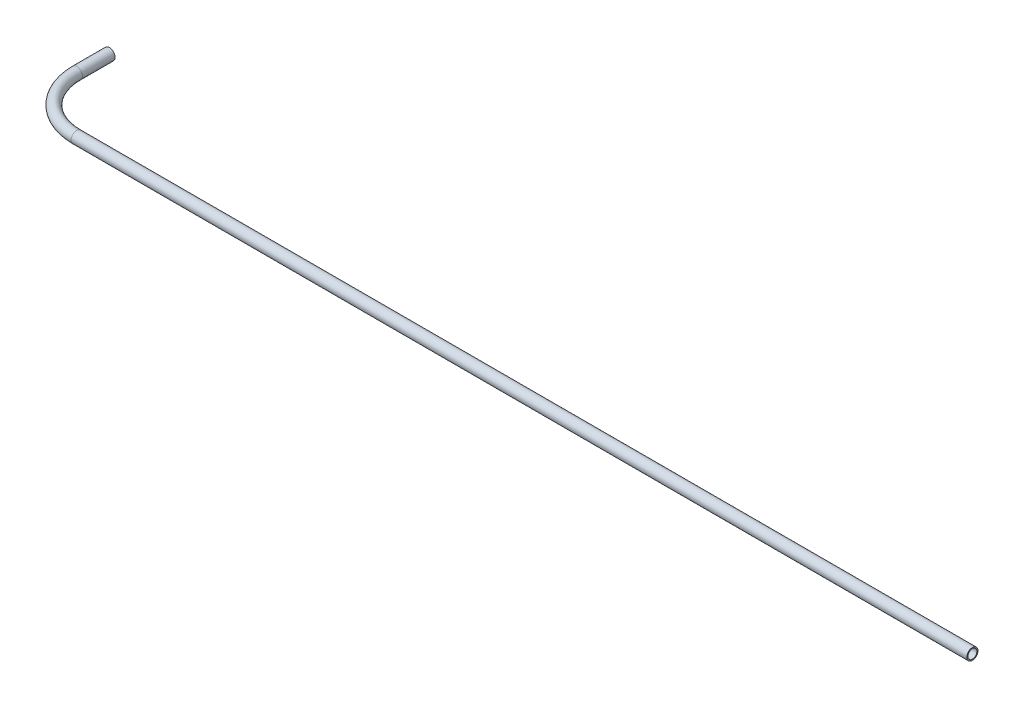
from build123d import *

# Parameters (mm, degrees)
SKETCH1_R           = 0.254
SKETCH1_R_2         = 0.2032
BOSS_EXTRUDE1_DEPTH = 40
SKETCH4_R           = 0.254
SKETCH4_R_2         = 0.2032


with BuildPart() as part:
    # Sketch1 → Boss-Extrude1 (new body)
    with BuildSketch(Plane(origin=(0, 0, 0), x_dir=(0, 0, -1), z_dir=(1, 0, 0))):
        Circle(SKETCH1_R)
        Circle(SKETCH1_R_2, mode=Mode.SUBTRACT)
    extrude(amount=BOSS_EXTRUDE1_DEPTH)

    # Sweep1: sweep along a path in Sketch3
    with BuildLine(Plane(origin=(-24.730187621, 0, -3.035061507), x_dir=(-1, 0, 0), z_dir=(0, -1, 0))) as sweep1_path:
        Line((-24.730187621, -3.035061507), (-24.313008201, -3.035061507))
        ThreePointArc((-24.313008201, -3.035061507), (-22.545241248, -2.30282846), (-21.813008201, -0.535061507))
        Line((-21.813008201, -0.535061507), (-21.813008201, 0.940936603))
    # Sketch4 → Sweep1 (sweep)
    with BuildSketch(Plane.ZY):
        Circle(SKETCH4_R)
        Circle(SKETCH4_R_2, mode=Mode.SUBTRACT)
    sweep(path=sweep1_path.line)


solid = part.part
